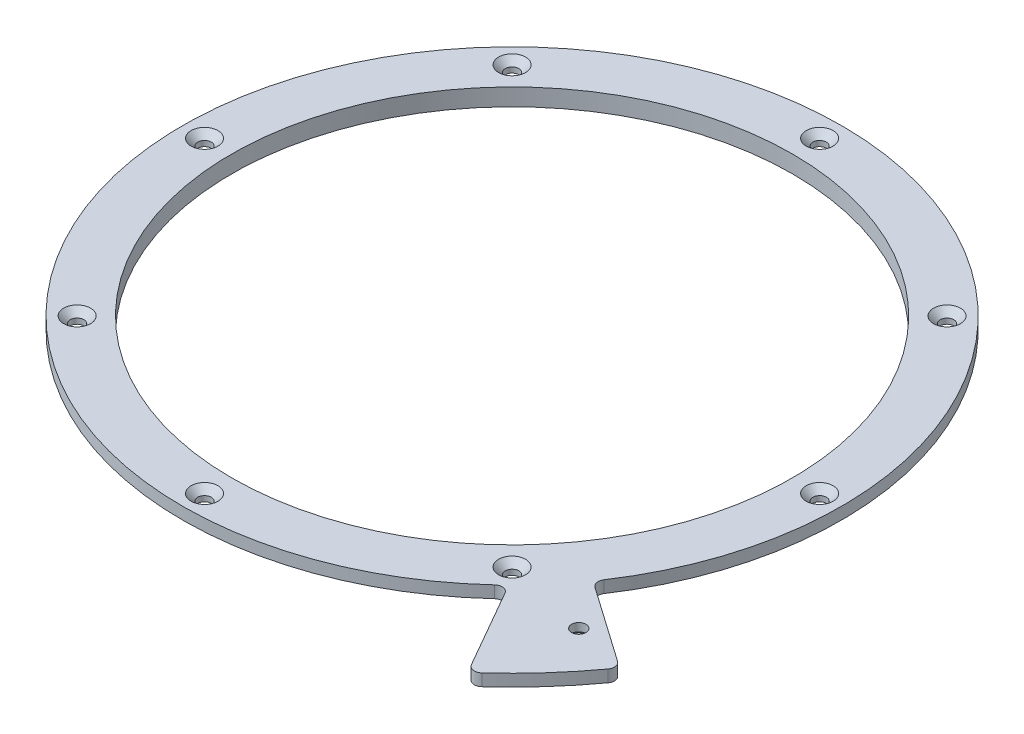
from build123d import *
from build123d.topology import SkipClean

# Parameters (mm, degrees)
ESBO_O1_R                                    = 82.26
ESBO_O1_R_2                                  = 70
RESSALTO_EXTRUS_O1_DEPTH                     = 3
RESSALTO_EXTRUS_O2_START                     = 1.3
ESBO_O2_R                                    = 73
ESBO_O2_R_2                                  = 70
RESSALTO_EXTRUS_O2_DEPTH                     = 1.3
ESCAREADO_PARA_PARAFUSO_ALLEN_SEXTAV_2_COUNT = 2
ESCAREADO_PARA_PARAFUSO_ALLEN_SEXTAV_2_PITCH = 76.76
ESCAREADO_PARA_PARAFUSO_ALLEN_SEXTAV_3_COUNT = 2
ESCAREADO_PARA_PARAFUSO_ALLEN_SEXTAV_3_PITCH = 76.76
ESCAREADO_PARA_PARAFUSO_ALLEN_SEXTAV_4_COUNT = 2
ESCAREADO_PARA_PARAFUSO_ALLEN_SEXTAV_4_PITCH = 76.76
ESCAREADO_PARA_PARAFUSO_ALLEN_SEXTAV_5_COUNT = 2
ESCAREADO_PARA_PARAFUSO_ALLEN_SEXTAV_5_PITCH = 76.76
ESCAREADO_PARA_PARAFUSO_ALLEN_SEXTAV_6_COUNT = 2
ESCAREADO_PARA_PARAFUSO_ALLEN_SEXTAV_6_PITCH = 76.76
ESCAREADO_PARA_PARAFUSO_ALLEN_SEXTAV_7_COUNT = 2
ESCAREADO_PARA_PARAFUSO_ALLEN_SEXTAV_7_PITCH = 76.76
ESCAREADO_PARA_PARAFUSO_ALLEN_SEXTAV_8_COUNT = 2
ESCAREADO_PARA_PARAFUSO_ALLEN_SEXTAV_8_PITCH = 76.76
ESCAREADO_PARA_PARAFUSO_ALLEN_SEXTAV_9_COUNT = 2
ESCAREADO_PARA_PARAFUSO_ALLEN_SEXTAV_9_PITCH = 76.76
RESSALTO_EXTRUS_O3_START                     = -3
RESSALTO_EXTRUS_O3_DEPTH                     = 3
FILETE1_R                                    = 2
ESBO_O9_R                                    = 1.8
CORTE_EXTRUS_O3_DEPTH                        = 122.035496877
CHANFRO2_SIZE                                = 1


with BuildPart() as part:
    # Esboço1 → Ressalto-extrusão1 (new body)
    with BuildSketch(Plane(origin=(0, 0, 0), x_dir=(1, 0, 0), z_dir=(0, 1, 0))):
        with Locations(Location((0, 0, 0), (0, 0, 270))):
            Circle(ESBO_O1_R)
        with Locations(Location((0, 0, 0), (0, 0, 270))):
            Circle(ESBO_O1_R_2, mode=Mode.SUBTRACT)
    extrude(amount=RESSALTO_EXTRUS_O1_DEPTH)

    # Esboço2 → Ressalto-extrusão2 (add)
    with SkipClean():  # the faces are left unmerged after this step: merging them gives an invalid solid
        with BuildSketch(Plane.XZ.offset(RESSALTO_EXTRUS_O2_START)):
            with Locations(Location((0, 0, 0), (0, 0, 270))):
                Circle(ESBO_O2_R)
            with Locations(Location((0, 0, 0), (0, 0, 270))):
                Circle(ESBO_O2_R_2, mode=Mode.SUBTRACT)
        extrude(amount=-RESSALTO_EXTRUS_O2_DEPTH)

    # Esboço4 → Escareado para parafuso Allen sextavado escareado de M31 (revolve, cut)
    with SkipClean():  # the faces are left unmerged after this step: merging them gives an invalid solid
        with BuildSketch(Plane(origin=(0, 3, 0), x_dir=(0, 0, 1), z_dir=(1, 0, 0))):
            Polygon((0, 0), (0, 3), (1.7, 3), (1.7, 1.66), (3.36, 0), align=None)
        escareado_para_parafuso_allen_sextavado = revolve(axis=Axis((0, 9.35, 0), (0, -1, 0)), mode=Mode.SUBTRACT)

    # Escareado para parafuso Allen sextav 2: Escareado para parafuso Allen sextavado escareado de M31 ×2
    with SkipClean():  # the faces are left unmerged after this step: merging them gives an invalid solid
        with Locations(*[(-i * ESCAREADO_PARA_PARAFUSO_ALLEN_SEXTAV_2_PITCH, 0, 0) for i in range(1, ESCAREADO_PARA_PARAFUSO_ALLEN_SEXTAV_2_COUNT)]):
            add(escareado_para_parafuso_allen_sextavado, mode=Mode.SUBTRACT)

    # Escareado para parafuso Allen sextav 3: Escareado para parafuso Allen sextavado escareado de M31 ×2
    with SkipClean():  # the faces are left unmerged after this step: merging them gives an invalid solid
        with Locations(*[Vector(-0.7071067811865477, 0, -0.7071067811865475) * (i * ESCAREADO_PARA_PARAFUSO_ALLEN_SEXTAV_3_PITCH) for i in range(1, ESCAREADO_PARA_PARAFUSO_ALLEN_SEXTAV_3_COUNT)]):
            add(escareado_para_parafuso_allen_sextavado, mode=Mode.SUBTRACT)

    # Escareado para parafuso Allen sextav 4: Escareado para parafuso Allen sextavado escareado de M31 ×2
    with SkipClean():  # the faces are left unmerged after this step: merging them gives an invalid solid
        with Locations(*[(0, 0, -i * ESCAREADO_PARA_PARAFUSO_ALLEN_SEXTAV_4_PITCH) for i in range(1, ESCAREADO_PARA_PARAFUSO_ALLEN_SEXTAV_4_COUNT)]):
            add(escareado_para_parafuso_allen_sextavado, mode=Mode.SUBTRACT)

    # Escareado para parafuso Allen sextav 5: Escareado para parafuso Allen sextavado escareado de M31 ×2
    with SkipClean():  # the faces are left unmerged after this step: merging them gives an invalid solid
        with Locations(*[Vector(0.7071067811865475, 0, -0.7071067811865476) * (i * ESCAREADO_PARA_PARAFUSO_ALLEN_SEXTAV_5_PITCH) for i in range(1, ESCAREADO_PARA_PARAFUSO_ALLEN_SEXTAV_5_COUNT)]):
            add(escareado_para_parafuso_allen_sextavado, mode=Mode.SUBTRACT)

    # Escareado para parafuso Allen sextav 6: Escareado para parafuso Allen sextavado escareado de M31 ×2
    with SkipClean():  # the faces are left unmerged after this step: merging them gives an invalid solid
        with Locations(*[(i * ESCAREADO_PARA_PARAFUSO_ALLEN_SEXTAV_6_PITCH, 0, 0) for i in range(1, ESCAREADO_PARA_PARAFUSO_ALLEN_SEXTAV_6_COUNT)]):
            add(escareado_para_parafuso_allen_sextavado, mode=Mode.SUBTRACT)

    # Escareado para parafuso Allen sextav 7: Escareado para parafuso Allen sextavado escareado de M31 ×2
    with SkipClean():  # the faces are left unmerged after this step: merging them gives an invalid solid
        with Locations(*[Vector(0.7071067811865477, 0, 0.7071067811865475) * (i * ESCAREADO_PARA_PARAFUSO_ALLEN_SEXTAV_7_PITCH) for i in range(1, ESCAREADO_PARA_PARAFUSO_ALLEN_SEXTAV_7_COUNT)]):
            add(escareado_para_parafuso_allen_sextavado, mode=Mode.SUBTRACT)

    # Escareado para parafuso Allen sextav 8: Escareado para parafuso Allen sextavado escareado de M31 ×2
    with SkipClean():  # the faces are left unmerged after this step: merging them gives an invalid solid
        with Locations(*[(0, 0, i * ESCAREADO_PARA_PARAFUSO_ALLEN_SEXTAV_8_PITCH) for i in range(1, ESCAREADO_PARA_PARAFUSO_ALLEN_SEXTAV_8_COUNT)]):
            add(escareado_para_parafuso_allen_sextavado, mode=Mode.SUBTRACT)

    # Escareado para parafuso Allen sextav 9: Escareado para parafuso Allen sextavado escareado de M31 ×2
    with SkipClean():  # the faces are left unmerged after this step: merging them gives an invalid solid
        with Locations(*[Vector(-0.7071067811865475, 0, 0.7071067811865476) * (i * ESCAREADO_PARA_PARAFUSO_ALLEN_SEXTAV_9_PITCH) for i in range(1, ESCAREADO_PARA_PARAFUSO_ALLEN_SEXTAV_9_COUNT)]):
            add(escareado_para_parafuso_allen_sextavado, mode=Mode.SUBTRACT)

    # Esboço5 → Ressalto-extrusão3 (add)
    with SkipClean():  # the faces are left unmerged after this step: merging them gives an invalid solid
        with BuildSketch(Plane(origin=(0, 3, 0), x_dir=(1, 0, 0), z_dir=(0, 1, 0)).offset(RESSALTO_EXTRUS_O3_START)):
            with BuildLine():
                Line((59.628675028, -61.836305796), (71.511245178, -82.577126452))
                ThreePointArc((71.511245178, -82.577126452), (81.110607536, -73.170413044), (89.482153659, -62.656078528))
                Line((89.482153659, -62.656078528), (67.383447163, -47.182397654))
                ThreePointArc((67.383447163, -47.182397654), (62.829570926, -53.09569302), (57.758469462, -58.57189433))
                Line((57.758469462, -58.57189433), (59.628675028, -61.836305796))
            make_face()
        extrude(amount=RESSALTO_EXTRUS_O3_DEPTH)
    add(part.part.scale(1), mode=Mode.REPLACE)  # the faces are merged on a copy

    # Filete1
    # the kernel refuses this fillet: 2 mm, written as the material it adds along each edge
    with BuildSketch(Plane(origin=(57.758469462, 0, 58.57189433), x_dir=(-0.7227263558173935, 0, 0.6911342956379103), z_dir=(0, 1, 0))) as filete1_piece_1:
        with BuildLine():
            CenterArc((2.55574236, 1.999764426), FILETE1_R, 166.088750143, 103.031841977)
            Line((0.61440377, 2.480601697), (0, 0))
            ThreePointArc((0, 0), (1.26252322, 0.009689149), (2.525046439, 0))
        make_face()
    extrude(amount=3)
    with BuildSketch(Plane(origin=(67.383447163, 0, 47.182397654), x_dir=(0.5638136312570139, 0, -0.8259020457710344), z_dir=(0, 1, 0))) as filete1_piece_2:
        with BuildLine():
            CenterArc((1.976403158, -1.999859125), FILETE1_R, 90.680051756, 88.639896488)
            Line((-0.023455967, -1.976121398), (0, 0))
            ThreePointArc((0, 0), (0.976332715, -0.005794184), (1.952665431, 0))
        make_face()
    extrude(amount=3)
    # the kernel refuses this fillet: 2 mm, written as the material it takes off along each edge
    with BuildSketch(Plane(origin=(89.482153659, -5.093472409, 62.656078528), x_dir=(-0.5811904962497088, 0, 0.8137675387166886), z_dir=(0, 1, 0))) as filete1_2_piece_1:
        with BuildLine():
            CenterArc((2.018737967, -1.999913033), FILETE1_R, 89.465680564, 91.068638872)
            Line((0.018824934, -2.01856403), (0, 0))
            ThreePointArc((0, 0), (1.018694482, 0.00475002), (2.037388964, 0))
        make_face()
    extrude(amount=13.186944818, mode=Mode.SUBTRACT)
    with BuildSketch(Plane(origin=(71.511245178, -6.20199849, 82.577126452), x_dir=(-0.4971059552935667, 0, -0.8676898462075434), z_dir=(0, 1, 0))) as filete1_2_piece_2:
        with BuildLine():
            CenterArc((2.457984349, -2), FILETE1_R, 90, 102.384853671)
            ThreePointArc((0.504526328, -2.428954266), (0.245367707, -1.215909412), (0, 0))
            Line((0, 0), (2.457984349, 0))
        make_face()
    extrude(amount=15.40399698, mode=Mode.SUBTRACT)

    # Esboço9 → Corte-extrusão3 (cut, through all)
    with BuildSketch(Plane(origin=(0, 3, 0), x_dir=(1, 0, 0), z_dir=(0, 1, 0))):
        with Locations(Location((75.866996657, -59.226515904, 0), (0, 0, 270))):
            Circle(ESBO_O9_R)
    extrude(amount=-CORTE_EXTRUS_O3_DEPTH, mode=Mode.SUBTRACT)

    # Chanfro2
    chanfro2_edges = [part.edges().sort_by_distance(p)[0] for p in [
        (75.866996657, 0, 57.426515904),
    ]]
    chamfer(chanfro2_edges, length=CHANFRO2_SIZE)


solid = part.part
